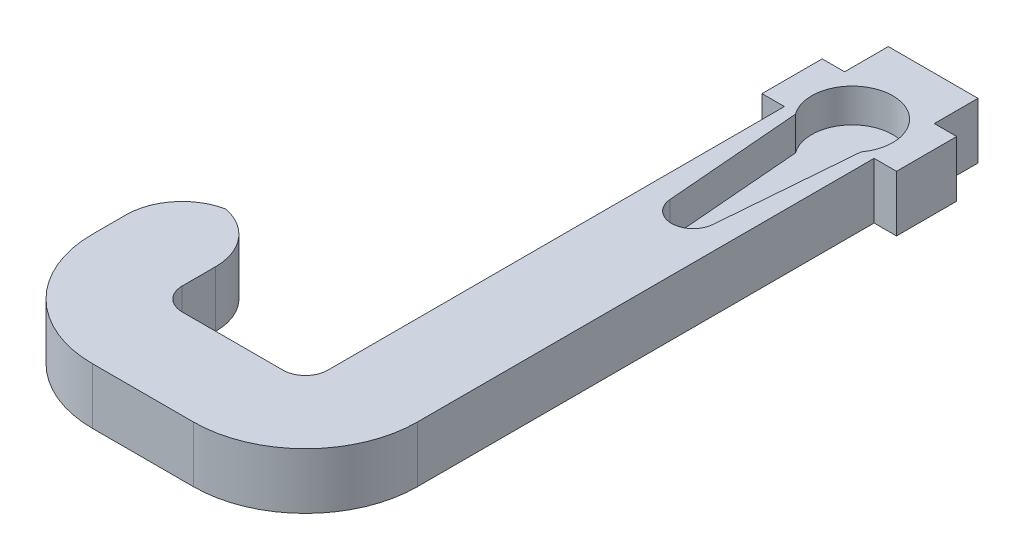
from build123d import *

# Parameters (mm, degrees)
BOSS_EXTRUDE1_DEPTH = 5
CUT_EXTRUDE3_DEPTH  = 3
FILLET2_R           = 10
FILLET3_R           = 5
FILLET4_R           = 2


with BuildPart() as part:
    # Sketch1 → Boss-Extrude1 (new body)
    with BuildSketch(Plane(origin=(0, 0, 0), x_dir=(1, 0, 0), z_dir=(0, 1, 0))):
        Polygon((0, 4), (13, 4), (13, 46.73), (11, 46.73), (11, 52.1), (13, 52.1), (13, 56), (21, 56), (21, 52.1), (23, 52.1), (23, 46.73), (21, 46.73), (21, 4), (21, -4), (13, -4), (0, -4), (-8, -4), (-8, 14), (0, 14), align=None)
    extrude(amount=BOSS_EXTRUDE1_DEPTH)

    # Sketch2 → Cut-Extrude3 (cut)
    with BuildSketch(Plane(origin=(0, 5, 0), x_dir=(1, 0, 0), z_dir=(0, 1, 0))):
        with BuildLine():
            Line((19.921, 46.641739258), (18.923587356, 34.436800493))
            ThreePointArc((18.923587356, 34.436800493), (17, 32.664), (15.076412644, 34.436800493))
            Line((15.076412644, 34.436800493), (14.079, 46.641739258))
            ThreePointArc((14.079, 46.641739258), (17, 52.4), (19.921, 46.641739258))
        make_face()
    extrude(amount=-CUT_EXTRUDE3_DEPTH, mode=Mode.SUBTRACT)

    # Fillet2
    fillet2_edges = [part.edges().sort_by_distance(p)[0] for p in [
        (21, 2.5, 4),
        (-8, 2.5, 4),
    ]]
    fillet(fillet2_edges, radius=FILLET2_R)

    # Fillet3
    # the kernel refuses this fillet: 5 mm, written as the material it takes off along each edge
    with BuildSketch(Plane(origin=(0, -12.5, -14), x_dir=(-1, 0, 0), z_dir=(0, 1, 0)), Plane(origin=(-8, -12.5, -14), x_dir=(0, 0, 1), z_dir=(0, 1, 0))) as fillet3_piece_1:
        with BuildLine():
            CenterArc((FILLET3_R, FILLET3_R), FILLET3_R, 180, 90)
            Line((0, FILLET3_R), (0, 0))
            Line((0, 0), (FILLET3_R, 0))
        make_face()
    extrude(amount=30, mode=Mode.SUBTRACT)

    # Fillet4
    fillet4_edges = [part.edges().sort_by_distance(p)[0] for p in [
        (0, 2.5, -4),
        (13, 2.5, -4),
    ]]
    fillet(fillet4_edges, radius=FILLET4_R)


solid = part.part
